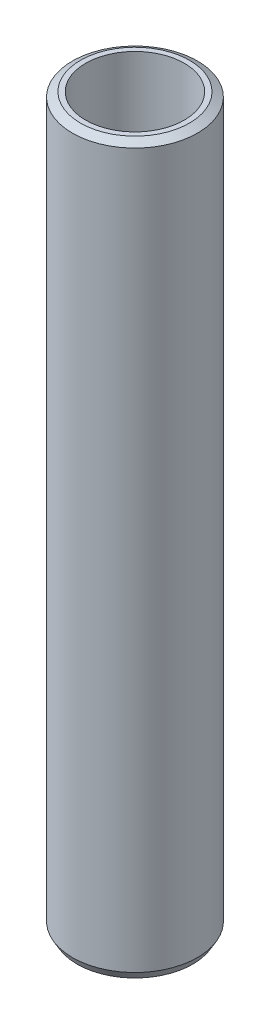
from build123d import *
from OCP.BRepFilletAPI import BRepFilletAPI_MakeChamfer

# Parameters (mm, degrees)
SKETCH1_R           = 37.5
BOSS_EXTRUDE1_DEPTH = 435.751842922
SKETCH2_R           = 29.575248023
CUT_EXTRUDE1_DEPTH  = 439.967161198
CHAMFER1_SIZE       = 2.787751705
CHAMFER1_SIZE2      = 4.828527592


with BuildPart() as part:
    # Sketch1 → Boss-Extrude1 (new body)
    with BuildSketch(Plane(origin=(0, 0, 0), x_dir=(1, 0, 0), z_dir=(0, 1, 0))):
        Circle(SKETCH1_R)
    extrude(amount=BOSS_EXTRUDE1_DEPTH)

    # Sketch2 → Cut-Extrude1 (cut, through all)
    with BuildSketch(Plane(origin=(0, 0, 0), x_dir=(1, 0, 0), z_dir=(0, 1, 0))):
        Circle(SKETCH2_R)
    extrude(amount=CUT_EXTRUDE1_DEPTH, mode=Mode.SUBTRACT)

    # Chamfer1: one chamfer whose edges measure the first distance from different faces: ONE call of the kernel's chamfer builder (chamfer() names one face for all edges)
    chamfer1_edges_1 = [part.edges().sort_by_distance(p)[0] for p in [
        (-37.5, 435.751842922, 0),
    ]]
    chamfer1_side_1 = [part.faces().sort_by_distance(p)[0] for p in [
        (-37.5, 217.875921461, 0),
    ]]
    chamfer1_edges_2 = [part.edges().sort_by_distance(p)[0] for p in [
        (-37.5, 0, 0),
    ]]
    chamfer1_side_2 = [part.faces().sort_by_distance(p)[0] for p in [
        (-36.439339828, 0, 0),
    ]]
    chamfer1 = BRepFilletAPI_MakeChamfer(part.part.solid().wrapped)
    for e in chamfer1_edges_1:
        chamfer1.Add(CHAMFER1_SIZE, CHAMFER1_SIZE2, e.wrapped, chamfer1_side_1[0].wrapped)  # the first distance lies on this face
    for e in chamfer1_edges_2:
        chamfer1.Add(CHAMFER1_SIZE, CHAMFER1_SIZE2, e.wrapped, chamfer1_side_2[0].wrapped)  # the first distance lies on this face
    add(Compound.cast(chamfer1.Shape()), mode=Mode.REPLACE)


solid = part.part
